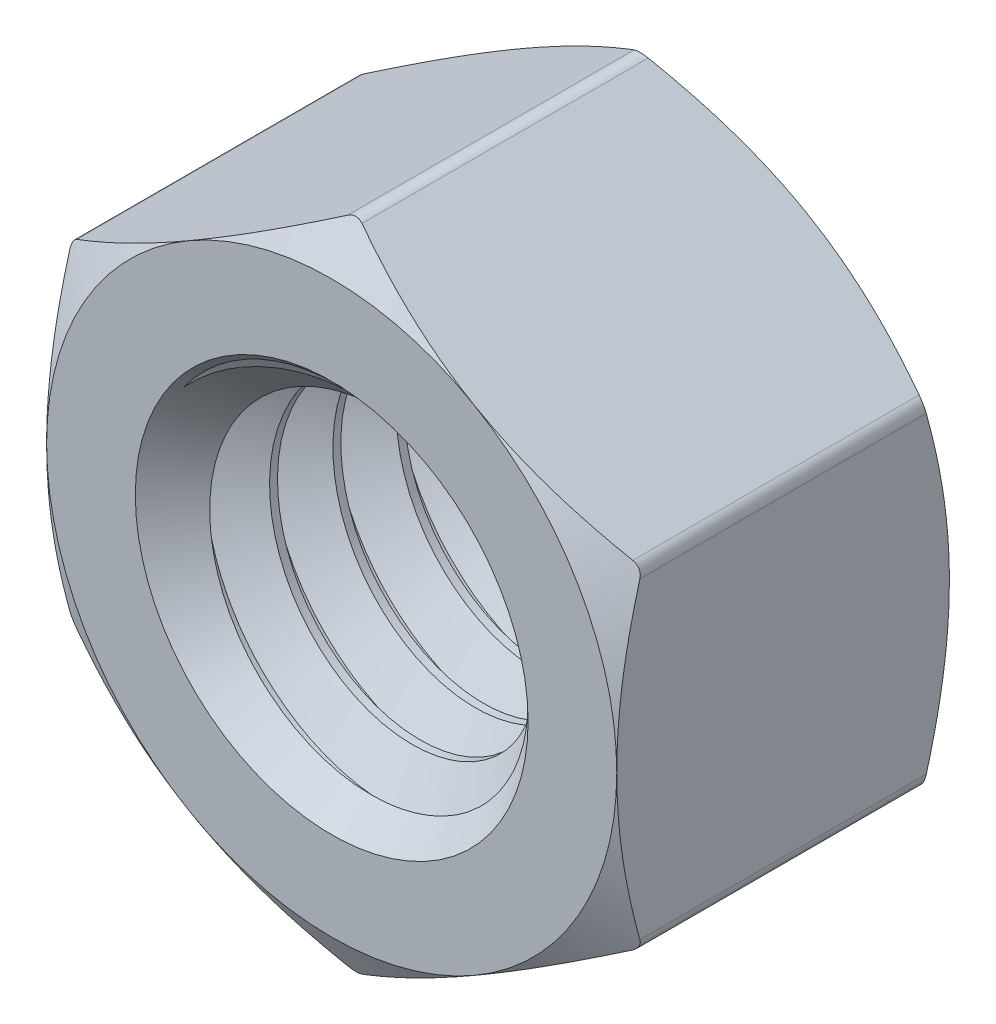
from build123d import *

# Parameters (mm, degrees)
BOSS_EXTRUDE2_DEPTH     = 4.1671875
CUT_EXTRUDE4_DEPTH      = 12.680874731
CUT_EXTRUDE4_DEPTH_BACK = 12.680874731
SKETCH16_R              = 4.7625
SKETCH7_OUTSIDE_W       = 71.99
SKETCH7_OUTSIDE_H       = 74.2
SKETCH7_OUTSIDE_R       = 7.14375
CUT_EXTRUDE5_DEPTH      = 14.730957339
CUT_EXTRUDE5_DRAFT      = -60
MIRROR4_COPY_1_SKETCH_W = 71.99
MIRROR4_COPY_1_SKETCH_H = 74.2
MIRROR4_COPY_1_SKETCH_R = 7.14375
MIRROR4_COPY_1_DEPTH    = 14.730957339
MIRROR4_COPY_1_DRAFT    = -60
FILLET2_R               = 0.3571875
SKETCH13_R              = 4.7625
BOSS_EXTRUDE1_DEPTH     = 8.334375
CUT_SWEEP1_PITCH        = 1.5875
SKETCH17_R              = 4.7625
BOSS_EXTRUDE3_DEPTH     = 8.334375


with BuildPart() as part:
    # Sketch15 → Boss-Extrude2 (new, symmetric)
    with BuildSketch(Plane.XY):
        Polygon((0, 8.248891971), (-7.14375, 4.124445986), (-7.14375, -4.124445986), (0, -8.248891971), (7.14375, -4.124445986), (7.14375, 4.124445986), align=None)
    extrude(amount=BOSS_EXTRUDE2_DEPTH, both=True)

    # Sketch16 → Cut-Extrude4 (cut, two sides: drawn at the far end of the back side and taken through both)
    with BuildSketch(Plane.XY.offset(-CUT_EXTRUDE4_DEPTH_BACK)):
        Circle(SKETCH16_R)
    extrude(amount=CUT_EXTRUDE4_DEPTH + CUT_EXTRUDE4_DEPTH_BACK, mode=Mode.SUBTRACT)


with BuildPart() as cut_extrude5_tool:
    # Sketch7 outside → Cut-Extrude5 (with draft: the straight prism first)
    with BuildSketch(Plane.XY.offset(4.1671875)):
        Rectangle(SKETCH7_OUTSIDE_W, SKETCH7_OUTSIDE_H)
        Circle(SKETCH7_OUTSIDE_R, mode=Mode.SUBTRACT)
    extrude(amount=-CUT_EXTRUDE5_DEPTH)
    # Cut-Extrude5: the draft: its side faces are tilted about the plane it starts from
    cut_extrude5_sides = [cut_extrude5_tool.faces().sort_by_distance(p)[0] for p in [
        (0, -37.1, -3.19829117),
        (35.995, 0, -3.19829117),
        (0, 37.1, -3.19829117),
        (-35.995, 0, -3.19829117),
        (-7.14375, 0, -3.19829117),
    ]]
    draft(cut_extrude5_sides, Plane.XY.offset(4.1671875), CUT_EXTRUDE5_DRAFT)


with BuildPart() as part_1:
    add(part.part)

    # Cut-Extrude5: cut by cut_extrude5_tool
    add(cut_extrude5_tool.part, mode=Mode.SUBTRACT)


with BuildPart() as mirror4_copy_1_tool:
    # Mirror4 copy 1 sketch → Mirror4 copy 1 (with draft: the straight prism first)
    with BuildSketch(Plane(origin=(0, 0, -4.1671875), x_dir=(1, 0, 0), z_dir=(0, 0, -1))):
        Rectangle(MIRROR4_COPY_1_SKETCH_W, MIRROR4_COPY_1_SKETCH_H)
        Circle(MIRROR4_COPY_1_SKETCH_R, mode=Mode.SUBTRACT)
    extrude(amount=-MIRROR4_COPY_1_DEPTH)
    # Mirror4 copy 1: the draft: its side faces are tilted about the plane it starts from
    mirror4_copy_1_sides = [mirror4_copy_1_tool.faces().sort_by_distance(p)[0] for p in [
        (0, -37.1, 3.19829117),
        (35.995, 0, 3.19829117),
        (0, 37.1, 3.19829117),
        (-35.995, 0, 3.19829117),
        (-7.14375, 0, 3.19829117),
    ]]
    draft(mirror4_copy_1_sides, Plane(origin=(0, 0, -4.1671875), x_dir=(1, 0, 0), z_dir=(0, 0, -1)), MIRROR4_COPY_1_DRAFT)


with BuildPart() as part_2:
    add(part_1.part)

    # Mirror4 copy 1: cut by mirror4_copy_1_tool
    add(mirror4_copy_1_tool.part, mode=Mode.SUBTRACT)

    # Fillet2
    fillet2_edges = [part_2.edges().sort_by_distance(p)[0] for p in [
        (-7.14375, 4.124445986, 0),
        (-7.14375, -4.124445986, 0),
        (0, -8.248891971, 0),
        (7.14375, -4.124445986, 0),
        (7.14375, 4.124445986, 0),
        (0, 8.248891971, 0),
    ]]
    fillet(fillet2_edges, radius=FILLET2_R)

    # Sketch17 → Boss-Extrude3 (add)
    with BuildSketch(Plane.XY.offset(4.1671875)):
        Circle(SKETCH17_R)
    extrude(amount=-BOSS_EXTRUDE3_DEPTH)


with BuildPart() as body_2:
    # Sketch13 → Boss-Extrude1 (new body)
    with BuildSketch(Plane(origin=(0, 0, -4.1671875), x_dir=(-1, 0, 0), z_dir=(0, 0, -1))):
        Circle(SKETCH13_R)
    extrude(amount=-BOSS_EXTRUDE1_DEPTH)

    # Cut-Sweep1: the profile of Sketch12 profile screwed along a right-hand helix of 6.25 turns, 8 arcs to a turn; built about Z, then put on its axis
    cut_sweep1_z = Axis((0, 0, 0), (0, 0, 1))
    cut_sweep1_corners = [(4.7628, 0, -1.389235705), (4.7628, 0, 0.000173205), (3.731388504, 0, -0.5953125), (3.731388504, 0, -0.79375)]
    with BuildLine(mode=Mode.PRIVATE) as cut_sweep1_profile:
        Line(cut_sweep1_corners[0], cut_sweep1_corners[1])
        Line(cut_sweep1_corners[1], cut_sweep1_corners[2])
        Line(cut_sweep1_corners[2], cut_sweep1_corners[3])
        Line(cut_sweep1_corners[3], cut_sweep1_corners[0])
    cut_sweep1_cap = Face(cut_sweep1_profile.wire())
    cut_sweep1_turn_angles = [0, 22.5, 45, 67.5, 90, 112.5, 135, 157.5, 180, 202.5, 225, 247.5, 270, 292.5, 315, 337.5, 360]
    cut_sweep1_turn_weights = [1, 0.9238795325112867, 1, 0.9238795325112867, 1, 0.9238795325112867, 1, 0.9238795325112867, 1, 0.9238795325112867, 1, 0.9238795325112867, 1, 0.9238795325112867, 1, 0.9238795325112867, 1]
    cut_sweep1_turn_rails = [Edge.make_bspline([Vector(p[0], p[1], 0).rotate(cut_sweep1_z, cut_sweep1_turn_angles[k]) / cut_sweep1_turn_weights[k] + Vector(0, 0, p[2] + CUT_SWEEP1_PITCH * cut_sweep1_turn_angles[k] / 360) for k in range(17)], [0, 0, 0, 1, 1, 2, 2, 3, 3, 4, 4, 5, 5, 6, 6, 7, 7, 8, 8, 8], 2, cut_sweep1_turn_weights) for p in cut_sweep1_corners]
    cut_sweep1_turn_sides = [Face.make_surface_from_curves(cut_sweep1_turn_rails[p[0]], cut_sweep1_turn_rails[p[1]]) for p in [(0, 1), (1, 2), (2, 3), (3, 0)]]
    cut_sweep1_last_angles = [2160, 2182.5, 2205, 2227.5, 2250]
    cut_sweep1_last_weights = [1, 0.9238795325112867, 1, 0.9238795325112776, 1]
    cut_sweep1_last_rails = [Edge.make_bspline([Vector(p[0], p[1], 0).rotate(cut_sweep1_z, cut_sweep1_last_angles[k]) / cut_sweep1_last_weights[k] + Vector(0, 0, p[2] + CUT_SWEEP1_PITCH * cut_sweep1_last_angles[k] / 360) for k in range(5)], [0, 0, 0, 1, 1, 2, 2, 2], 2, cut_sweep1_last_weights) for p in cut_sweep1_corners]
    cut_sweep1_last_sides = [Face.make_surface_from_curves(cut_sweep1_last_rails[p[0]], cut_sweep1_last_rails[p[1]]) for p in [(0, 1), (1, 2), (2, 3), (3, 0)]]
    cut_sweep1 = Plane(origin=(0, 0, -4.1671875), x_dir=(0, 1, 0), z_dir=(0, 0, 1)) * Solid(Shell([*[p.moved(Location((0, 0, CUT_SWEEP1_PITCH * i))) for i in range(6) for p in cut_sweep1_turn_sides], *cut_sweep1_last_sides, cut_sweep1_cap, cut_sweep1_cap.rotate(cut_sweep1_z, 2250).moved(Location((0, 0, CUT_SWEEP1_PITCH * 2250 / 360)))]))
    add(cut_sweep1, mode=Mode.SUBTRACT)


with BuildPart() as part_3:
    add(part_2.part)

    # Combine1: cut body 2
    add(body_2.part, mode=Mode.SUBTRACT)

    # Cut-Extrude2 cone 1 section (through the dimple's axis) → Cut-Extrude2 (revolve, cut)
    with BuildSketch(Plane(origin=(0, 0, 4.1671875), x_dir=(0, -1, 0), z_dir=(1, 0, 0))):
        Polygon((0, 0), (4.92125, 0), (0, 4.92125), align=None)
    revolve(axis=Axis((0, 0, 4.1671875), (0, 0, -1)), mode=Mode.SUBTRACT)

    # Cut-Extrude3 cone 1 section (through the dimple's axis) → Cut-Extrude3 (revolve, cut)
    with BuildSketch(Plane(origin=(0, 0, -4.1671875), x_dir=(0, 1, 0), z_dir=(1, 0, 0))):
        Polygon((0, 0), (4.92125, 0), (0, 4.92125), align=None)
    revolve(axis=Axis((0, 0, -4.1671875), (0, 0, 1)), mode=Mode.SUBTRACT)


solid = part_3.part
